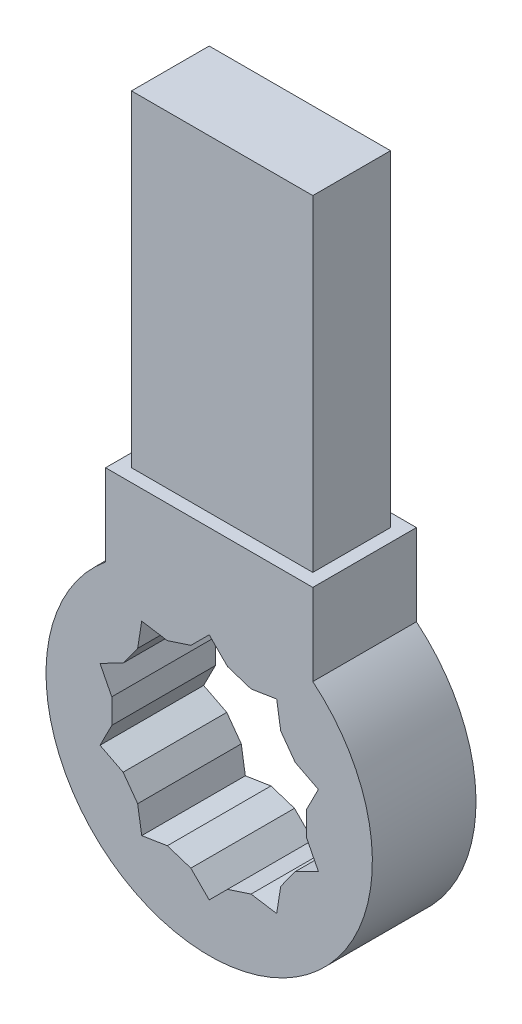
from build123d import *

# Parameters (mm, degrees)
BOSS_EXTRUDE2_DEPTH      = 25.4
CUT_EXTRUDE2_START       = 50.900485433
CUT_EXTRUDE2_OUTLINE_W   = 50.8
CUT_EXTRUDE2_OUTLINE_H   = 25.4
CUT_EXTRUDE2_OUTLINE_W_2 = 44.45
CUT_EXTRUDE2_OUTLINE_H_2 = 19.05
CUT_EXTRUDE2_DEPTH       = 80


# Read off the part's stored shape, not the designer's step: Cut-Extrude2
with BuildPart() as part:
    # Sketch2 → Boss-Extrude2 (new body)
    with BuildSketch(Plane.XY):
        with BuildLine():
            Line((-25.4, 130.900485433), (25.4, 130.900485433))
            Line((25.4, 130.900485433), (25.4, 30.900485433))
            ThreePointArc((25.4, 30.900485433), (0, -40), (-25.4, 30.900485433))
            Line((-25.4, 30.900485433), (-25.4, 130.900485433))
        make_face()
        Polygon((-16.541112452, 22.766888123), (-10.26013758, 21.772079433), (-4.496681536, 23.64473982), (0, 28.141421356), (4.496681536, 23.64473982), (10.26013758, 21.772079433), (16.541112452, 22.766888123), (17.535921141, 16.485913251), (21.09793287, 11.583224708), (26.764082159, 8.696177445), (23.877034895, 3.030028156), (23.877034895, -3.030028156), (26.764082159, -8.696177445), (21.09793287, -11.583224708), (17.535921141, -16.485913251), (16.541112452, -22.766888123), (10.26013758, -21.772079433), (4.496681536, -23.64473982), (0, -28.141421356), (-4.496681536, -23.64473982), (-10.26013758, -21.772079433), (-16.541112452, -22.766888123), (-17.535921141, -16.485913251), (-21.09793287, -11.583224708), (-26.764082159, -8.696177445), (-23.877034895, -3.030028156), (-23.877034895, 3.030028156), (-26.764082159, 8.696177445), (-21.09793287, 11.583224708), (-17.535921141, 16.485913251), align=None, mode=Mode.SUBTRACT)
    extrude(amount=BOSS_EXTRUDE2_DEPTH)

    # Cut-Extrude2 outline → Cut-Extrude2 (cut)
    with BuildSketch(Plane(origin=(0, 0, 0), x_dir=(1, 0, 0), z_dir=(0, 1, 0)).offset(CUT_EXTRUDE2_START)):
        with Locations((0, -12.7)):
            Rectangle(CUT_EXTRUDE2_OUTLINE_W, CUT_EXTRUDE2_OUTLINE_H)
        with Locations((0, -12.7)):
            Rectangle(CUT_EXTRUDE2_OUTLINE_W_2, CUT_EXTRUDE2_OUTLINE_H_2, mode=Mode.SUBTRACT)
    extrude(amount=CUT_EXTRUDE2_DEPTH, mode=Mode.SUBTRACT)


solid = part.part
